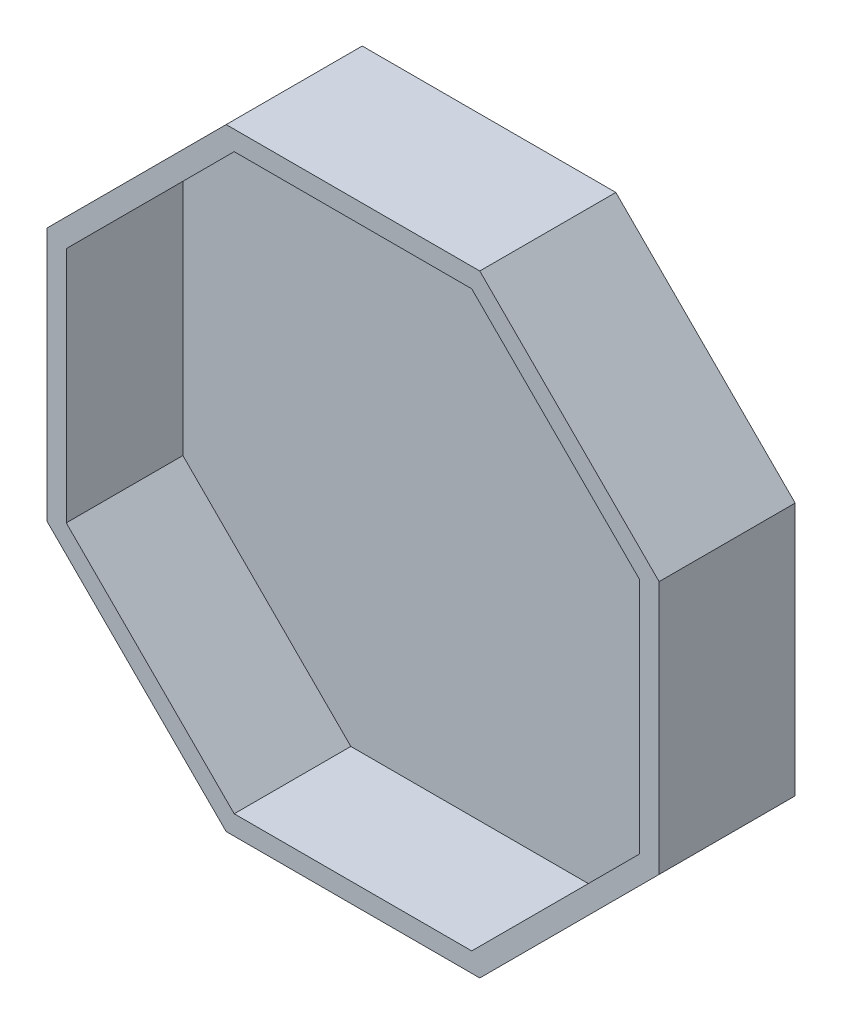
from build123d import *

# Parameters (mm, degrees)
BOSS_EXTRUDE1_DEPTH = 14
SHELL1_T            = -2


with BuildPart() as part:
    # Sketch1 → Boss-Extrude1 (new body)
    with BuildSketch(Plane.XY):
        Polygon((31.5, -13.047727215), (31.5, 13.047727215), (13.047727215, 31.5), (-13.047727215, 31.5), (-31.5, 13.047727215), (-31.5, -13.047727215), (-13.047727215, -31.5), (13.047727215, -31.5), align=None)
    extrude(amount=BOSS_EXTRUDE1_DEPTH)

    # Shell1
    shell1_openings = [part.faces().sort_by_distance(p)[0] for p in [
        (0, 0, 14),
    ]]
    offset(amount=SHELL1_T, openings=shell1_openings, kind=Kind.INTERSECTION)


solid = part.part
